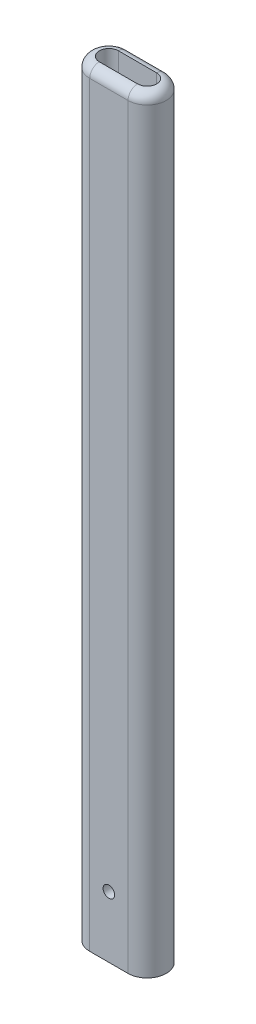
from build123d import *

# Parameters (mm, degrees)
BOSS_EXTRUDE1_DEPTH = 200
SKETCH2_R           = 3
CUT_EXTRUDE1_DEPTH  = 203.546291005
FILLET1_R           = 5


with BuildPart() as part:
    # Sketch1 → Boss-Extrude1 (new, symmetric)
    with BuildSketch(Plane(origin=(0, 0, 0), x_dir=(1, 0, 0), z_dir=(0, 1, 0))):
        with BuildLine():
            Line((-15, 10), (5, 10))
            ThreePointArc((5, 10), (15, 0), (5, -10))
            Line((5, -10), (-15, -10))
            ThreePointArc((-15, -10), (-25, 0), (-15, 10))
        make_face()
        with BuildLine():
            Line((-15, 5), (5, 5))
            ThreePointArc((5, 5), (10, 0), (5, -5))
            Line((5, -5), (-15, -5))
            ThreePointArc((-15, -5), (-20, 0), (-15, 5))
        make_face(mode=Mode.SUBTRACT)
    extrude(amount=BOSS_EXTRUDE1_DEPTH, both=True)

    # Sketch2 → Cut-Extrude1 (cut, through all)
    with BuildSketch(Plane.XY.offset(10)):
        with Locations((-5, -168)):
            Circle(SKETCH2_R)
    extrude(amount=-CUT_EXTRUDE1_DEPTH, mode=Mode.SUBTRACT)

    # Fillet1
    fillet1_edges = [part.edges().sort_by_distance(p)[0] for p in [
        (15, 200, 0),
        (-5, 200, -10),
        (-25, 200, 0),
        (-5, 200, 10),
    ]]
    fillet(fillet1_edges, radius=FILLET1_R - 0.0001)  # a hair under: the kernel refuses the full size


solid = part.part
